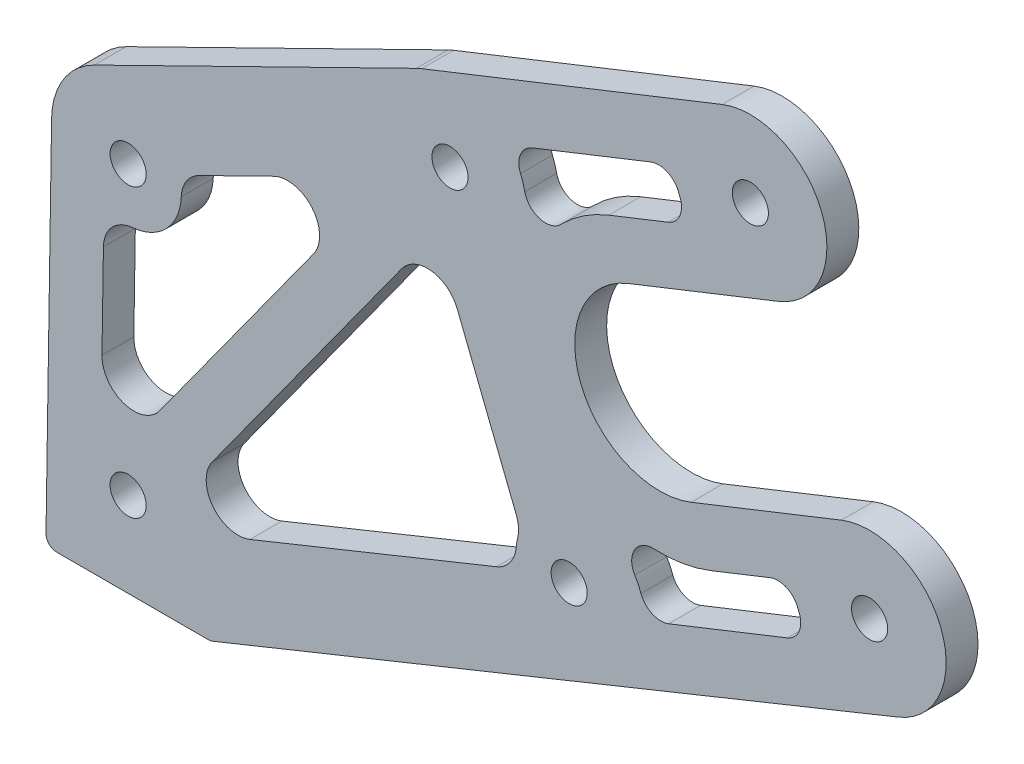
from build123d import *

# Parameters (mm, degrees)
BOSS_EXTRUDE1_DEPTH  = 3
M3_CLEARANCE_HOLE1_D = 3.4
FILLET1_R            = 1
CUT_EXTRUDE1_DEPTH   = 98.809398098
FILLET2_R            = 3


with BuildPart() as part:
    # Sketch1 → Boss-Extrude1 (new body)
    with BuildSketch(Plane.XY):
        with BuildLine():
            Line((-7.745, -8), (7.745, -8))
            Line((7.745, -8), (72.454643525, 18.148708125))
            ThreePointArc((72.454643525, 18.148708125), (76.442590098, 27.504628545), (67.099151295, 31.521731493))
            Line((67.099151295, 31.521731493), (52.968440939, 25.913877639))
            ThreePointArc((52.968440939, 25.913877639), (42.58163342, 30.398766664), (47.066522445, 40.785574183))
            Line((47.066522445, 40.785574183), (61.197232801, 46.393428037))
            ThreePointArc((61.197232801, 46.393428037), (65.235200277, 55.745184727), (55.883443586, 59.783152204))
            Line((55.883443586, 59.783152204), (27.622022875, 48.567444496))
            ThreePointArc((27.622022875, 48.567444496), (27.360445509, 48.457625207), (27.103395633, 48.337590398))
            Line((27.103395633, 48.337590398), (-3.17552185, 33.465007985))
            ThreePointArc((-3.17552185, 33.465007985), (-6.083996143, 30.855549014), (-7.201934402, 27.111391848))
            Line((-7.201934402, 27.111391848), (-7.745, -8))
        make_face()
    extrude(amount=BOSS_EXTRUDE1_DEPTH)

    # M3 Clearance Hole1 (through all)
    with Locations(Plane(origin=(0, 0, 0), x_dir=(1, 0, 0), z_dir=(0, 0, -1))):
        with Locations((58.540338194, -53.08829012), (69.756045902, -24.826869409), (41.494625191, -13.611161701), (30.278917483, -41.872582412), (0, -27), (0, 0)):
            Hole(M3_CLEARANCE_HOLE1_D / 2)

    # Fillet1
    fillet1_edges = [part.edges().sort_by_distance(p)[0] for p in [
        (7.745, -8, 1.5),
        (-7.745, -8, 1.5),
    ]]
    fillet(fillet1_edges, radius=FILLET1_R)

    # Sketch4 → Cut-Extrude1 (cut, through all)
    with BuildSketch(Plane(origin=(0, 0, 0), x_dir=(-1, 0, 0), z_dir=(0, 0, -1))):
        with BuildLine():
            Line((-36.665533999, 12.315060525), (-1.803445379, -1.772462297))
            Line((-1.803445379, -1.772462297), (-28.940870149, 35.755763597))
            Line((-28.940870149, 35.755763597), (-36.924312556, 15.639028171))
            ThreePointArc((-36.924312556, 15.639028171), (-36.509709113, 13.999248929), (-36.665533999, 12.315060525))
        make_face()
        with BuildLine():
            Line((2.610514463, 0.656369995), (-24.498312938, 38.145048713))
            Line((-24.498312938, 38.145048713), (-4.7819016, 28.460622159))
            ThreePointArc((-4.7819016, 28.460622159), (-3.212584236, 23.168642208), (2.271949216, 22.545985321))
            Line((2.271949216, 22.545985321), (2.610514463, 0.656369995))
        make_face()
        with BuildLine():
            Line((-62.016843947, 19.385602393), (-50.858917301, 14.95751489))
            ThreePointArc((-50.858917301, 14.95751489), (-49.308169583, 14.989178913), (-48.246409758, 16.119880982))
            ThreePointArc((-48.246409758, 16.119880982), (-47.982873968, 16.738923692), (-47.662727001, 17.330676096))
            ThreePointArc((-47.662727001, 17.330676096), (-47.65538264, 19.383992588), (-49.461031316, 20.361640487))
            ThreePointArc((-49.461031316, 20.361640487), (-52.184659665, 20.531639484), (-54.812790469, 21.266472469))
            Line((-54.812790469, 21.266472469), (-60.391753791, 23.480516221))
            ThreePointArc((-60.391753791, 23.480516221), (-61.94250151, 23.448852198), (-63.004261335, 22.318150128))
            ThreePointArc((-63.004261335, 22.318150128), (-63.061183818, 22.169974802), (-63.121357719, 22.02308982))
            ThreePointArc((-63.121357719, 22.02308982), (-63.123874165, 20.47202091), (-62.016843947, 19.385602393))
        make_face()
        with BuildLine():
            Line((-49.176046083, 51.741936932), (-38.018119437, 47.313849428))
            ThreePointArc((-38.018119437, 47.313849428), (-36.91108922, 46.227430911), (-36.913605666, 44.676362002))
            ThreePointArc((-36.913605666, 44.676362002), (-37.146272847, 44.045068907), (-37.319021075, 43.394820463))
            ThreePointArc((-37.319021075, 43.394820463), (-38.721665588, 41.895236879), (-40.706331051, 42.421796994))
            ThreePointArc((-40.706331051, 42.421796994), (-42.805349267, 44.165693083), (-45.222172916, 45.432979353))
            Line((-45.222172916, 45.432979353), (-50.801136239, 47.647023104))
            ThreePointArc((-50.801136239, 47.647023104), (-51.908166456, 48.733441621), (-51.905650011, 50.284510531))
            ThreePointArc((-51.905650011, 50.284510531), (-51.84547611, 50.431395513), (-51.788553626, 50.579570839))
            ThreePointArc((-51.788553626, 50.579570839), (-50.726793801, 51.710272908), (-49.176046083, 51.741936932))
        make_face()
    extrude(amount=-CUT_EXTRUDE1_DEPTH, mode=Mode.SUBTRACT)

    # Fillet2
    fillet2_edges = [part.edges().sort_by_distance(p)[0] for p in [
        (-2.271949216, 22.545985321, 1.5),
        (4.7819016, 28.460622159, 1.5),
        (-2.610514463, 0.656369995, 1.5),
        (24.498312938, 38.145048713, 1.5),
        (28.940870149, 35.755763597, 1.5),
        (36.924312556, 15.639028171, 1.5),
        (36.665533999, 12.315060525, 1.5),
        (1.803445379, -1.772462297, 1.5),
    ]]
    fillet(fillet2_edges, radius=FILLET2_R)


solid = part.part
